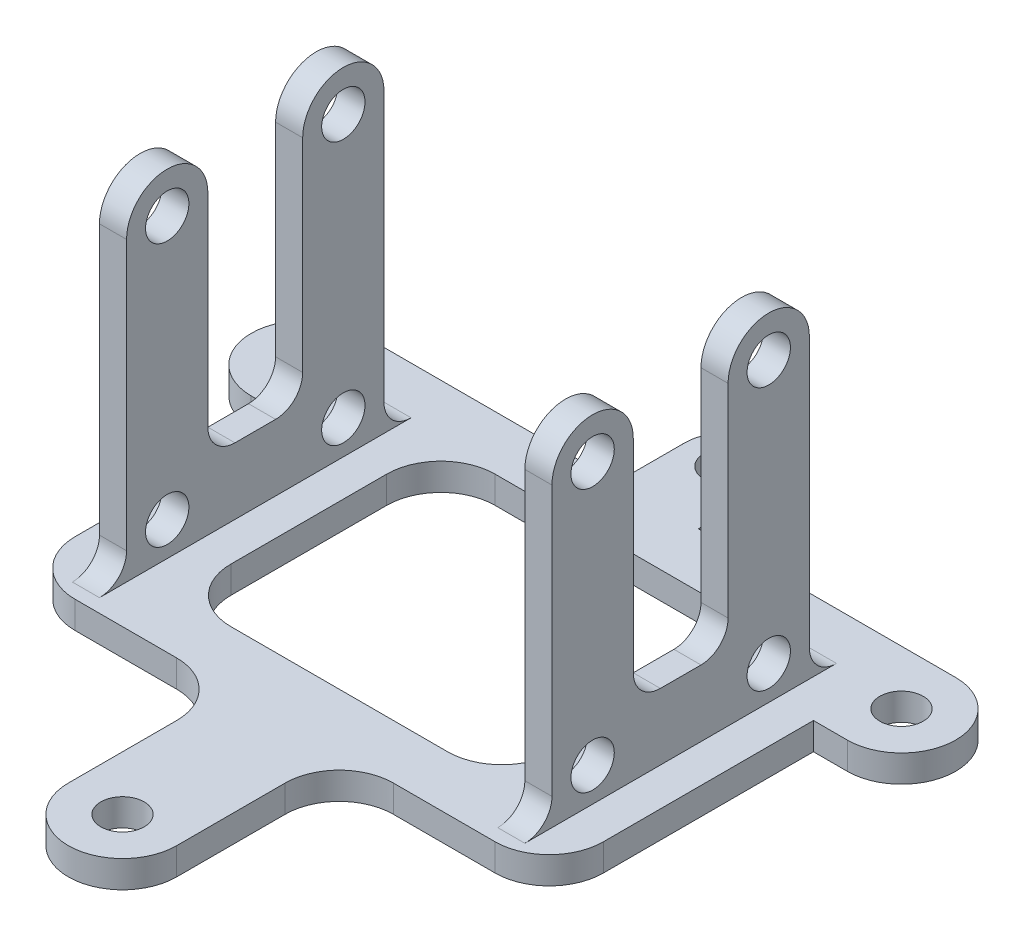
from build123d import *
from build123d.topology import SkipClean

# Parameters (mm, degrees)
SKETCH1_R                 = 1.6000000000000019
SKETCH1_R_2               = 1.5999999999999972
BOSS_EXTRUDE1_DEPTH       = 2
BOSS_EXTRUDE3_START       = -2
SKETCH2_R                 = 4
BOSS_EXTRUDE3_DEPTH       = 2
CUT_EXTRUDE2_START        = -4
SKETCH4_R                 = 1.5999999999999994
CUT_EXTRUDE2_DEPTH        = 4
CUT_EXTRUDE3_DEPTH        = 10
SKETCH6_R                 = 3
SKETCH6_R_2               = 1.6
BOSS_EXTRUDE4_DEPTH       = 2
SKETCH7_R                 = 1.5999999999999974
CUT_EXTRUDE4_DEPTH        = 10
CUT_EXTRUDE6_DEPTH        = 9.500000000000002
FILLET3_R                 = 3
SKETCH9_R                 = 1.5999999999999999
BOSS_EXTRUDE5_DEPTH       = 2
SKETCH10_R                = 1.6000000000000003
BOSS_EXTRUDE6_DEPTH       = 2
SKETCH11_R                = 1.6
CUT_EXTRUDE7_DEPTH        = 10
BOSS_EXTRUDE7_DEPTH       = 2
SKETCH13_R                = 1.6
CUT_EXTRUDE9_DEPTH        = 5.500000000000001
BOSS_EXTRUDE8_START       = -2
BOSS_EXTRUDE8_DEPTH       = 2
SKETCH16_R                = 1.5999999999999994
CUT_EXTRUDE10_DEPTH       = 10
SKETCH17_R                = 2.8848996867032946
BOSS_EXTRUDE9_DEPTH       = 0.9999999999999966
SKETCH18_R                = 1.5999999999999992
BOSS_EXTRUDE10_DEPTH      = 3
CUT_EXTRUDE11_START       = -2
SKETCH19_R                = 1.5999999999999985
SKETCH19_R_2              = 1.5000000000000004
CUT_EXTRUDE11_DEPTH       = 2
SKETCH20_R                = 1.5999999999999994
CUT_EXTRUDE12_DEPTH       = 10
SKETCH21_R                = 1.5000000000000018
CUT_EXTRUDE13_DEPTH       = 8.5
BOSS_EXTRUDE12_DEPTH      = 25
BOSS_EXTRUDE12_DEPTH_BACK = 1.9999999999999931
CUT_EXTRUDE14_DEPTH       = 48
SKETCH24_R                = 1.6000000000000019
SKETCH24_R_2              = 1.6
CUT_EXTRUDE15_DEPTH       = 48
BOSS_EXTRUDE13_DEPTH      = 2
BOSS_EXTRUDE14_DEPTH      = 2
CUT_EXTRUDE16_DEPTH       = 48
FILLET4_R                 = 3
CUT_EXTRUDE17_DEPTH       = 48
SKETCH29_R                = 4.000000000000001
SKETCH29_R_2              = 1.5999999999999979
BOSS_EXTRUDE15_DEPTH      = 2
FILLET5_R                 = 3
SKETCH30_R                = 1.5999999999999994
BOSS_EXTRUDE16_DEPTH      = 2
BOSS_EXTRUDE17_DEPTH      = 2
CUT_EXTRUDE18_DEPTH       = 10
FILLET6_R                 = 4
FILLET7_R                 = 2
SKETCH35_W                = 24
SKETCH35_H                = 7.9999999999999964
CUT_EXTRUDE19_DEPTH       = 10
FILLET8_R                 = 4
BOSS_EXTRUDE18_DEPTH      = 0.2
BOSS_EXTRUDE18_DEPTH_BACK = 33.2
SKETCH37_R                = 1.6000000000000019
CUT_EXTRUDE20_DEPTH       = 10
CUT_EXTRUDE20_DEPTH_BACK  = 31.2
SKETCH38_W                = 29.4
SKETCH38_H                = 8.202433025908348


with BuildPart() as part:
    # Sketch1 → Boss-Extrude1 (new body)
    with BuildSketch(Plane(origin=(0, 0, 0), x_dir=(1, 0, 0), z_dir=(0, 1, 0))):
        with BuildLine():
            Line((-3.999999999999999, -45), (-3.9999999999999964, -30))
            Line((-3.9999999999999964, -30), (-3.9999999999999982, -19))
            Line((-3.9999999999999982, -19), (-21.999999999999993, -19.000000000000007))
            ThreePointArc((-21.999999999999993, -19.000000000000007), (-24.828427124746185, -17.8284271247462), (-25.999999999999993, -15.000000000000007))
            Line((-25.999999999999993, -15.000000000000007), (-26, -5.000000000000007))
            ThreePointArc((-26, -5.000000000000007), (-24.82842712474619, -2.171572875253817), (-22, -1.000000000000006))
            Line((-22, -1.000000000000006), (-4, -1.0000000000000018))
            Line((-4, -1.0000000000000018), (-4, 0))
            ThreePointArc((-4, 0), (2.4e-16, 4), (4, 0))
            Line((4, 0), (4, -1.0000000000000009))
            Line((4, -1.0000000000000009), (22, -1.0000000000000009))
            ThreePointArc((22, -1.0000000000000009), (24.82842712474619, -2.17157287525381), (26, -5))
            Line((26, -5), (26, -15))
            ThreePointArc((26, -15), (24.82842712474619, -17.82842712474619), (22, -19))
            Line((22, -19), (4.0000000000000036, -19))
            Line((4.0000000000000036, -19), (4.0000000000000036, -30))
            Line((4.0000000000000036, -30), (4.000000000000003, -45))
            ThreePointArc((4.000000000000003, -45), (1.1e-15, -49), (-3.999999999999999, -45))
        make_face()
        with Locations(Location((-22, -5.000000000000005, 0), (0, 0, 270))):
            Circle(SKETCH1_R, mode=Mode.SUBTRACT)
        with Locations(Location((0, 0, 0), (0, 0, 270))):
            Circle(SKETCH1_R_2, mode=Mode.SUBTRACT)
        with Locations(Location((22, -5, 0), (0, 0, 270))):
            Circle(SKETCH1_R, mode=Mode.SUBTRACT)
        with Locations(Location((22, -15, 0), (0, 0, 270))):
            Circle(SKETCH1_R, mode=Mode.SUBTRACT)
        with Locations(Location((-21.999999999999993, -15.000000000000007, 0), (0, 0, 270))):
            Circle(SKETCH1_R, mode=Mode.SUBTRACT)
        with BuildLine():
            ThreePointArc((-1.5999999999999976, -45), (1.54e-15, -46.6), (1.6000000000000012, -45))
            Line((1.6000000000000012, -45), (1.6000000000000032, -30))
            ThreePointArc((1.6000000000000032, -30), (3.77e-15, -28.400000000000002), (-1.5999999999999956, -30))
            Line((-1.5999999999999956, -30), (-1.5999999999999976, -45))
        make_face(mode=Mode.SUBTRACT)
    extrude(amount=BOSS_EXTRUDE1_DEPTH)

    # Sketch2 → Boss-Extrude3 (add)
    with BuildSketch(Plane(origin=(0, 2, 0), x_dir=(1, 0, 0), z_dir=(0, 1, 0)).offset(BOSS_EXTRUDE3_START)):
        with BuildLine():
            ThreePointArc((-3.708099243547754, 1.500000000000191), (-2.7973447819472734, 2.8591715882248763), (-1.4185908501044255, 3.74))
            ThreePointArc((-1.4185908501044262, 3.7400000000000015), (4.5e-16, 4.6000000000000005), (1.4185908501044269, 3.74))
            ThreePointArc((1.4185908501044269, 3.7399999999999998), (2.797344781947271, 2.859171588224878), (3.708099243547752, 1.500000000000196))
            ThreePointArc((3.7080992435479154, 1.5000000000002072), (3.9263467099959257, 2.235930950172584), (4, 2.999999999999999))
            ThreePointArc((4, 3), (2.4e-16, 7), (-4, 3.0000000000000004))
            ThreePointArc((-4, 3.0000000000000004), (-3.9263467099959253, 2.235930950172582), (-3.708099243547913, 1.500000000000202))
        make_face()
        with BuildLine():
            ThreePointArc((4, 2.999999999999999), (3.9263467099959257, 2.235930950172584), (3.7080992435479154, 1.5000000000002072))
            ThreePointArc((3.708099243547752, 1.500000000000196), (3.9263467099958844, 0.764069049827629), (4, 0))
            Line((4, 0), (4, 3))
        make_face()
        with BuildLine():
            ThreePointArc((-4, 4.9e-16), (-3.926346709995885, 0.7640690498276264), (-3.708099243547754, 1.500000000000191))
            ThreePointArc((-3.708099243547913, 1.500000000000202), (-3.9263467099959253, 2.235930950172582), (-4, 3.0000000000000004))
            Line((-4, 3), (-4, 0))
        make_face()
        Circle(SKETCH2_R)
    extrude(amount=BOSS_EXTRUDE3_DEPTH)

    # Sketch4 → Cut-Extrude2 (cut)
    with SkipClean():  # the faces are left unmerged after this step: merging them gives an invalid solid
        with BuildSketch(Plane(origin=(0, 2, 0), x_dir=(1, 0, 0), z_dir=(0, 1, 0)).offset(CUT_EXTRUDE2_START)):
            with Locations(Location((0, 3, 0), (0, 0, 270))):
                Circle(SKETCH4_R)
        extrude(amount=CUT_EXTRUDE2_DEPTH, mode=Mode.SUBTRACT)

    # Sketch5 → Cut-Extrude3 (cut)
    with BuildSketch(Plane(origin=(0, 2, 0), x_dir=(1, 0, 0), z_dir=(0, 1, 0))):
        Polygon((-4, -1.0000000000000018), (4, -1.0000000000000009), (9.121752044416558, 12.895203900090412), (-11.957584594920363, 14.407484273922782), align=None)
    extrude(amount=-CUT_EXTRUDE3_DEPTH, mode=Mode.SUBTRACT)

    # Sketch6 → Boss-Extrude4 (add)
    with BuildSketch(Plane(origin=(0, 2, 0), x_dir=(1, 0, 0), z_dir=(0, 1, 0))):
        with Locations((0, -1.0000000000000036)):
            Circle(SKETCH6_R)
        with Locations((0, -1.0000000000000036)):
            Circle(SKETCH6_R_2, mode=Mode.SUBTRACT)
    extrude(amount=-BOSS_EXTRUDE4_DEPTH)

    # Sketch7 → Cut-Extrude4 (cut)
    with BuildSketch(Plane(origin=(0, 2, 0), x_dir=(1, 0, 0), z_dir=(0, 1, 0))):
        with Locations(Location((0, -1.0000000000000009, 0), (0, 0, 270))):
            Circle(SKETCH7_R)
    extrude(amount=-CUT_EXTRUDE4_DEPTH, mode=Mode.SUBTRACT)

    # Sketch8 → Cut-Extrude6 (cut)
    with BuildSketch(Plane(origin=(0, 2, 0), x_dir=(1, 0, 0), z_dir=(0, 1, 0))):
        Polygon((-17.999999999999996, -5.000000000000005), (18, -5), (18, -15), (-17.99999999999999, -15.000000000000007), align=None)
    extrude(amount=-CUT_EXTRUDE6_DEPTH, mode=Mode.SUBTRACT)

    # Fillet3
    fillet3_edges = [part.edges().sort_by_distance(p)[0] for p in [
        (-17.999999999999996, 1, 5.000000000000005),
        (18, 1, 5),
        (18, 1, 15),
        (-17.99999999999999, 1, 15.000000000000007),
    ]]
    fillet(fillet3_edges, radius=FILLET3_R)

    # Sketch9 → Boss-Extrude5 (add)
    with BuildSketch(Plane(origin=(0, 2, 0), x_dir=(1, 0, 0), z_dir=(0, 1, 0))):
        with Locations((0, -1.0000000000000036)):
            Circle(SKETCH9_R)
    extrude(amount=-BOSS_EXTRUDE5_DEPTH)

    # Sketch10 → Boss-Extrude6 (add)
    with BuildSketch(Plane(origin=(0, 2, 0), x_dir=(1, 0, 0), z_dir=(0, 1, 0))):
        with BuildLine():
            Line((3.0000000000000004, -1.0000000000000009), (3.0000000000000004, 2.999999999999999))
            ThreePointArc((3.0000000000000004, 2.999999999999999), (-6.8e-16, 6), (-3.0000000000000004, 2.999999999999999))
            Line((-3.0000000000000004, 2.999999999999999), (-3.0000000000000004, -1.0000000000000244))
            Line((-3.0000000000000004, -1.0000000000000244), (3.0000000000000004, -1.0000000000000009))
        make_face()
        with Locations((-8.7e-16, 2.999999999999999)):
            Circle(SKETCH10_R, mode=Mode.SUBTRACT)
    extrude(amount=-BOSS_EXTRUDE6_DEPTH)

    # Sketch11 → Cut-Extrude7 (cut)
    with BuildSketch(Plane(origin=(0, 2, 0), x_dir=(1, 0, 0), z_dir=(0, 1, 0))):
        with Locations(Location((-8.7e-16, 2.999999999999999, 0), (0, 0, 270))):
            Circle(SKETCH11_R)
    extrude(amount=-CUT_EXTRUDE7_DEPTH, mode=Mode.SUBTRACT)

    # Sketch12 → Boss-Extrude7 (add)
    with BuildSketch(Plane(origin=(0, 2, 0), x_dir=(1, 0, 0), z_dir=(0, 1, 0))):
        with BuildLine():
            Line((-3.0000000000000013, 2.9999999999999996), (-3, 3.999999999999999))
            ThreePointArc((-3, 3.999999999999999), (1.8e-16, 6.999999999999999), (3, 3.999999999999999))
            Line((3, 3.999999999999999), (3.0000000000000004, 2.999999999999999))
            Line((3.0000000000000004, 2.999999999999999), (2.8284271247461903, 2.999999999999999))
            ThreePointArc((2.8284271247461903, 2.999999999999999), (1.8e-16, 0.9999999999999991), (-2.8284271247461903, 2.999999999999999))
            Line((-2.8284271247461903, 2.999999999999999), (-3.0000000000000013, 2.9999999999999996))
        make_face()
    extrude(amount=-BOSS_EXTRUDE7_DEPTH)

    # Sketch13 → Cut-Extrude9 (cut)
    with BuildSketch(Plane(origin=(0, 2, 0), x_dir=(1, 0, 0), z_dir=(0, 1, 0))):
        with Locations(Location((0, 3.999999999999999, 0), (0, 0, 270))):
            Circle(SKETCH13_R)
    extrude(amount=-CUT_EXTRUDE9_DEPTH, mode=Mode.SUBTRACT)

    # Sketch15 → Boss-Extrude8 (add)
    with BuildSketch(Plane(origin=(0, 2, 0), x_dir=(1, 0, 0), z_dir=(0, 1, 0)).offset(BOSS_EXTRUDE8_START)):
        with BuildLine():
            Line((-3.999999999999999, -45), (-3.999999999999999, -23.95375005686752))
            Line((-3.999999999999999, -23.95375005686752), (4.000000000000003, -23.95375005686752))
            Line((4.000000000000003, -23.95375005686752), (4.000000000000003, -45))
            ThreePointArc((4.000000000000003, -45), (1.1e-15, -49), (-3.999999999999999, -45))
        make_face()
    extrude(amount=BOSS_EXTRUDE8_DEPTH)

    # Sketch16 → Cut-Extrude10 (cut)
    with BuildSketch(Plane(origin=(0, 2, 0), x_dir=(1, 0, 0), z_dir=(0, 1, 0))):
        with Locations(Location((1.84e-15, -45, 0), (0, 0, 270))):
            Circle(SKETCH16_R)
        with Locations(Location((4.9e-15, -36.00000000000001, 0), (0, 0, 270))):
            Circle(SKETCH16_R)
    extrude(amount=-CUT_EXTRUDE10_DEPTH, mode=Mode.SUBTRACT)

    # Sketch17 → Boss-Extrude9 (add)
    with BuildSketch(Plane(origin=(0, 2, 0), x_dir=(1, 0, 0), z_dir=(0, 1, 0))):
        with Locations((4.9e-15, -36.00000000000001)):
            Circle(SKETCH17_R)
    extrude(amount=-BOSS_EXTRUDE9_DEPTH)

    # Sketch18 → Boss-Extrude10 (add)
    with BuildSketch(Plane(origin=(0, 1.0000000000000036, 0), x_dir=(-1, 0, 0), z_dir=(0, -1, 0))):
        with Locations(Location((-4.9e-15, -36.00000000000001, 0), (0, 0, 270))):
            Circle(SKETCH18_R)
    extrude(amount=BOSS_EXTRUDE10_DEPTH)

    # Sketch19 → Cut-Extrude11 (cut)
    with BuildSketch(Plane(origin=(0, -1.9999999999999967, 0), x_dir=(-1, 0, 0), z_dir=(0, -1, 0)).offset(CUT_EXTRUDE11_START)):
        with Locations((-4.9e-15, -36.00000000000001)):
            Circle(SKETCH19_R)
        with Locations(Location((-4.9e-15, -36.00000000000001, 0), (0, 0, 90))):
            Circle(SKETCH19_R_2, mode=Mode.SUBTRACT)
    extrude(amount=CUT_EXTRUDE11_DEPTH, mode=Mode.SUBTRACT)

    # Sketch20 → Cut-Extrude12 (cut)
    with BuildSketch(Plane(origin=(0, 0, 0), x_dir=(-1, 0, 0), z_dir=(0, -1, 0))):
        with Locations(Location((5.5e-16, -40.5, 0), (0, 0, 90))):
            Circle(SKETCH20_R)
    extrude(amount=-CUT_EXTRUDE12_DEPTH, mode=Mode.SUBTRACT)

    # Sketch21 → Cut-Extrude13 (cut)
    with BuildSketch(Plane(origin=(0, 0, 0), x_dir=(-1, 0, 0), z_dir=(0, -1, 0))):
        with Locations((-4.9e-15, -36.00000000000001)):
            Circle(SKETCH21_R)
    extrude(amount=CUT_EXTRUDE13_DEPTH, mode=Mode.SUBTRACT)

    # Sketch22 → Boss-Extrude12 (add, two sides: drawn at the far end of the back side and taken through both)
    with BuildSketch(Plane(origin=(0, 2, 0), x_dir=(1, 0, 0), z_dir=(0, 1, 0)).offset(-BOSS_EXTRUDE12_DEPTH_BACK)):
        Polygon((-16.499999999999993, -15.000000000000007), (-16.499999999999993, -6.500000000000005), (-14.664886756065696, -6.500000000000005), (-14.664886756065695, -25.500000000000004), (-16.499999999999993, -25.500000000000004), align=None)
        Polygon((16.499999999999993, -25.500000000000004), (16.499999999999993, -15.000000000000007), (16.499999999999993, -6.500000000000005), (14.499999999999995, -6.500000000000005), (14.499999999999993, -25.500000000000004), align=None)
    extrude(amount=BOSS_EXTRUDE12_DEPTH + BOSS_EXTRUDE12_DEPTH_BACK)

    # Sketch23 → Cut-Extrude14 (cut)
    with BuildSketch(Plane(origin=(16.499999999999993, 0, 0), x_dir=(0, 0, -1), z_dir=(1, 0, 0))):
        with BuildLine():
            Line((-25.500000000000004, 27.000000000000004), (-25.500000000000004, 23.9))
            ThreePointArc((-25.500000000000007, 23.9), (-22.500000000000007, 26.9), (-19.500000000000007, 23.9))
            Line((-19.500000000000004, 23.9), (-19.5, 6.899999999999999))
            Line((-19.5, 6.899999999999997), (-12.500000000000007, 6.899999999999997))
            Line((-12.500000000000007, 6.899999999999997), (-12.500000000000007, 23.9))
            ThreePointArc((-12.500000000000007, 23.9), (-9.500000000000007, 26.9), (-6.500000000000007, 23.9))
            Line((-6.500000000000005, 23.9), (-6.500000000000005, 27.000000000000004))
            Line((-6.500000000000005, 27.000000000000004), (-25.500000000000007, 27.000000000000004))
        make_face()
    extrude(amount=-CUT_EXTRUDE14_DEPTH, mode=Mode.SUBTRACT)

    # Sketch24 → Cut-Extrude15 (cut)
    with BuildSketch(Plane(origin=(16.499999999999993, 0, 0), x_dir=(0, 0, -1), z_dir=(1, 0, 0))):
        with Locations((-22.500000000000007, 23.9)):
            Circle(SKETCH24_R)
        with Locations((-9.500000000000007, 23.9)):
            Circle(SKETCH24_R_2)
        with Locations((-22.500000000000004, 4.500000000000001)):
            Circle(SKETCH24_R)
        with Locations((-9.500000000000007, 4.500000000000001)):
            Circle(SKETCH24_R_2)
    extrude(amount=-CUT_EXTRUDE15_DEPTH, mode=Mode.SUBTRACT)

    # Sketch25 → Boss-Extrude13 (add)
    with BuildSketch(Plane(origin=(0, 0, 0), x_dir=(-1, 0, 0), z_dir=(0, -1, 0))):
        Polygon((14.664886756065696, -6.500000000000005), (14.664886756065696, -3.5087335984680297), (19.1283871992999, -3.5087335984680297), (19.1283871992999, -15.856455710850426), (14.664886756065696, -15.856455710850426), align=None)
        Polygon((-14.499999999999995, -6.783756667702066), (-14.499999999999993, -16.697340012410514), (-19.375262398451664, -16.697340012410514), (-19.375262398451664, -3.5087335984680297), (-14.499999999999995, -3.5087335984680297), align=None)
    extrude(amount=-BOSS_EXTRUDE13_DEPTH)

    # Sketch26 → Boss-Extrude14 (add)
    with BuildSketch(Plane(origin=(0, 0, 0), x_dir=(-1, 0, 0), z_dir=(0, -1, 0))):
        Polygon((14.664886756065695, -25.500000000000004), (-14.499999999999993, -25.500000000000004), (-14.499999999999993, -19), (14.664886756065695, -19.000000000000007), align=None)
    extrude(amount=-BOSS_EXTRUDE14_DEPTH)

    # Sketch27 → Cut-Extrude16 (cut)
    with BuildSketch(Plane(origin=(0, 2, 0), x_dir=(1, 0, 0), z_dir=(0, 1, 0))):
        Polygon((4.0000000000000036, -20.500000000000004), (-3.9999999999999964, -20.500000000000004), (-11.999999999999996, -20.500000000000004), (-11.999999999999996, -15.000000000000007), (4.0000000000000036, -15.000000000000002), (12.000000000000004, -15), (12.000000000000004, -20.500000000000004), align=None)
    extrude(amount=-CUT_EXTRUDE16_DEPTH, mode=Mode.SUBTRACT)

    # Fillet4
    # the kernel refuses this fillet: 3 mm, written as the material it adds along each edge
    with BuildSketch(Plane(origin=(-3.999999999999996, 2, 25.500000000000004), x_dir=(-1, 0, 0), z_dir=(0, -1, 0))) as fillet4_piece_1:
        with BuildLine():
            CenterArc((FILLET4_R, -FILLET4_R), FILLET4_R, 90, 90)
            Line((4.4e-16, -FILLET4_R), (0, 0))
            Line((0, 0), (FILLET4_R, 0))
        make_face()
    extrude(amount=2)
    with BuildSketch(Plane(origin=(4.0000000000000036, 0, 25.500000000000004), x_dir=(1, 0, 0), z_dir=(0, 1, 0))) as fillet4_piece_2:
        with BuildLine():
            CenterArc((FILLET4_R, -FILLET4_R), FILLET4_R, 90, 90)
            Line((0, -FILLET4_R), (0, 0))
            Line((0, 0), (FILLET4_R, 0))
        make_face()
    extrude(amount=2)
    with BuildSketch(Plane(origin=(16.499999999999993, 2, 19), x_dir=(1, 0, 0), z_dir=(0, -1, 0)), Plane(origin=(-16.499999999999993, 2, 19.000000000000007), x_dir=(0, 0, 1), z_dir=(0, -1, 0))) as fillet4_piece_3:
        with BuildLine():
            CenterArc((FILLET4_R, FILLET4_R), FILLET4_R, 180, 90)
            Line((0, FILLET4_R), (0, 0))
            Line((0, 0), (FILLET4_R, 0))
        make_face()
    extrude(amount=1.9999999999999931)
    # the kernel refuses this fillet: 3 mm, written as the material it takes off along each edge
    with BuildSketch(Plane(origin=(12.000000000000004, 9.395099728875287, 15), x_dir=(1, 0, 1.2008e-13), z_dir=(0, -1, 0))) as fillet4_2_piece_1:
        with BuildLine():
            CenterArc((3.0000000000003553, 2.9580398915497548), FILLET4_R, 179.99999999999312, 80.40593177314037)
            Line((3.5521e-13, 2.958039891550115), (0, 0))
            Line((0, 0), (2.5000000000000426, 0))
        make_face()
    extrude(amount=16.790199457750575, mode=Mode.SUBTRACT)
    with BuildSketch(Plane(origin=(-11.999999999999996, 9.453061079910315, 15.000000000000007), x_dir=(0, 0, 1), z_dir=(0, -1, 0))) as fillet4_2_piece_2:
        with BuildLine():
            CenterArc((2.981224431964126, 3), FILLET4_R, 186.41357694190813, 83.5864230580919)
            Line((-1.78e-15, 2.6648867560657017), (0, 0))
            Line((0, 0), (2.981224431964126, 0))
        make_face()
    extrude(amount=16.90612215982063, mode=Mode.SUBTRACT)

    # Sketch28 → Cut-Extrude17 (cut)
    with BuildSketch(Plane(origin=(0, 2, 0), x_dir=(1, 0, 0), z_dir=(0, 1, 0))):
        with BuildLine():
            Line((-3.999999999999999, -45), (-3.9999999999999982, -40.5))
            Line((-4.000000000000005, -40.5), (-24.834858507184848, -51.1299447852437))
            Line((-24.834858507184848, -51.1299447852437), (5.50593116836319, -58.37718786368524))
            Line((5.50593116836319, -58.37718786368524), (27.5856147441333, -52.63196407611241))
            Line((27.5856147441333, -52.63196407611241), (27.5856147441333, -52.218908771123516))
            Line((27.5856147441333, -52.218908771123516), (4.0000000000000036, -40.5))
            Line((4.000000000000003, -40.5), (4.000000000000003, -45))
            ThreePointArc((4.000000000000002, -45), (1.75e-15, -49), (-3.9999999999999982, -45))
        make_face()
        with BuildLine():
            ThreePointArc((-1.4097714550789981, -44.24333333333334), (-3.2893073602444054, -42.77606175000636), (-4.000000000000005, -40.5))
            Line((-3.9999999999999982, -40.5), (-3.999999999999999, -45))
            ThreePointArc((-3.9999999999999982, -45), (1.75e-15, -49), (4.000000000000002, -45))
            Line((4.000000000000003, -45), (4.000000000000003, -40.5))
            ThreePointArc((4.0000000000000036, -40.5), (3.2893073602444036, -42.77606175000636), (1.409771455078996, -44.24333333333334))
            ThreePointArc((1.4097714550789944, -44.243333333333325), (1.5517142662433694, -44.6098938145366), (1.6000000000000012, -45))
            ThreePointArc((1.6000000000000012, -45), (-0.3901061854633988, -46.551714266243366), (-1.4097714550789913, -44.243333333333325))
        make_face()
    extrude(amount=-CUT_EXTRUDE17_DEPTH, mode=Mode.SUBTRACT)

    # Sketch29 → Boss-Extrude15 (add)
    with BuildSketch(Plane(origin=(0, 2, 0), x_dir=(1, 0, 0), z_dir=(0, 1, 0))):
        with Locations((-5.5e-16, -40.5)):
            Circle(SKETCH29_R)
        with Locations(Location((-5.5e-16, -40.5, 0), (0, 0, 90))):
            Circle(SKETCH29_R_2, mode=Mode.SUBTRACT)
    extrude(amount=-BOSS_EXTRUDE15_DEPTH)

    # Fillet5
    fillet5_edges = [part.edges().sort_by_distance(p)[0] for p in [
        (-14.664886756065698, 1.0000000000000036, 15.000000000000007),
        (14.499999999999995, 1.0000000000000036, 15),
    ]]
    fillet(fillet5_edges, radius=FILLET5_R)

    # Sketch30 → Boss-Extrude16 (add)
    # profile 1 of 3: a face of its own
    with BuildSketch(Plane(origin=(0, 2, 0), x_dir=(1, 0, 0), z_dir=(0, 1, 0))):
        with BuildLine():
            ThreePointArc((-13.332443378032846, -15.487381030197795), (-12.353996422347327, -16.56748291844433), (-11.999999999999996, -17.981224431964137))
            Line((-11.999999999999996, -17.981224431964137), (-11.999999999999996, -5.0000000000000036))
            Line((-11.999999999999996, -5.000000000000004), (-14.664886756065696, -5.000000000000004))
            Line((-14.664886756065696, -5.000000000000004), (-14.664886756065695, -12.993537628431456))
            ThreePointArc((-14.664886756065695, -12.993537628431456), (-14.310890333718365, -14.407279141951264), (-13.332443378032846, -15.487381030197795))
        make_face()
    # profile 2 of 3: a face of its own
    with BuildSketch(Plane(origin=(0, 2, 0), x_dir=(1, 0, 0), z_dir=(0, 1, 0))):
        with BuildLine():
            Line((12.000000000000004, -5), (12.000000000000004, -17.958039891549806))
            ThreePointArc((12.000000000000004, -17.958039891549806), (12.330730436992173, -16.588733497786894), (13.249999999999998, -15.521341305347566))
            ThreePointArc((13.249999999999998, -15.521341305347567), (14.169269563007823, -14.453949112908244), (14.499999999999993, -13.08464271914533))
            Line((14.499999999999993, -13.084642719145329), (14.499999999999995, -5.000000000000001))
            Line((14.499999999999995, -5.000000000000001), (12.000000000000004, -5.000000000000001))
        make_face()
    # profile 3 of 3: a face of its own
    with BuildSketch(Plane(origin=(0, 2, 0), x_dir=(1, 0, 0), z_dir=(0, 1, 0))):
        with BuildLine():
            Line((12.000000000000004, -20.500000000000004), (-11.999999999999996, -20.500000000000004))
            Line((-11.999999999999996, -20.500000000000004), (-14.664886756065693, -20.500000000000004))
            Line((-14.664886756065695, -20.500000000000004), (-14.664886756065695, -25.500000000000004))
            Line((-14.664886756065695, -25.500000000000004), (-6.9999999999999964, -25.500000000000004))
            ThreePointArc((-6.9999999999999964, -25.500000000000004), (-4.8786796564403545, -26.37867965644036), (-3.9999999999999956, -28.500000000000004))
            Line((-3.9999999999999964, -28.500000000000004), (-4, -40.50000000000001))
            ThreePointArc((-4.000000000000002, -40.50000000000001), (2.64e-15, -44.5), (4.000000000000007, -40.50000000000001))
            Line((4.000000000000005, -40.50000000000001), (4.0000000000000036, -28.500000000000004))
            ThreePointArc((4.000000000000003, -28.500000000000004), (4.878679656440362, -26.37867965644036), (7.000000000000003, -25.500000000000004))
            Line((7.000000000000003, -25.500000000000004), (14.499999999999993, -25.500000000000004))
            Line((14.499999999999993, -25.500000000000004), (14.499999999999993, -20.5))
            Line((14.499999999999993, -20.5), (12.000000000000004, -20.500000000000004))
        make_face()
        with Locations(Location((-5.5e-16, -40.5, 0), (0, 0, 90))):
            Circle(SKETCH30_R, mode=Mode.SUBTRACT)
    extrude(amount=-BOSS_EXTRUDE16_DEPTH)

    # Sketch31 → Boss-Extrude17 (add)
    with BuildSketch(Plane(origin=(0, 2, 0), x_dir=(1, 0, 0), z_dir=(0, 1, 0))):
        Polygon((-19.499999999999993, -19.000000000000007), (-19.499999999999993, -28.500000000000004), (-3.9999999999999964, -28.500000000000004), (-3.9999999999999964, -20.500000000000004), (-14.664886756065695, -20.500000000000004), (-14.664886756065695, -19.000000000000007), align=None)
        Polygon((14.499999999999993, -19.000000000000007), (19.499999999999993, -19.000000000000007), (19.499999999999993, -28.500000000000004), (3.9999999999999964, -28.500000000000004), (3.9999999999999964, -20.500000000000004), (14.499999999999993, -20.500000000000004), align=None)
    extrude(amount=-BOSS_EXTRUDE17_DEPTH)

    # Sketch34 → Cut-Extrude18 (cut)
    with BuildSketch(Plane.XZ):
        with BuildLine():
            Line((-19.499999999999993, 19.000000000000007), (-19.499999999999993, 9.000000000000005))
            Line((-19.499999999999993, 9.000000000000005), (-22, 9.000000000000005))
            ThreePointArc((-22, 9.000000000000005), (-24.82842712474619, 7.828427124746195), (-26, 5.000000000000005))
            Line((-26, 5.000000000000005), (-35.11330830520048, 22.636347709612025))
            Line((-35.11330830520048, 22.636347709612025), (-23.296728077087415, 23.169426516895324))
            Line((-23.296728077087415, 23.169426516895324), (-19.499999999999993, 19.000000000000007))
        make_face()
        with BuildLine():
            Line((19.499999999999993, 19.000000000000007), (19.499999999999996, 9.000000000000005))
            Line((19.499999999999996, 9.000000000000005), (22, 9.000000000000004))
            ThreePointArc((22, 9.000000000000004), (24.82842712474619, 7.82842712474619), (26, 5))
            Line((26, 5), (32.36558405007679, 16.283825256152742))
            Line((32.36558405007679, 16.283825256152742), (22.37035641351498, 25.21289527814796))
            Line((22.37035641351498, 25.21289527814796), (19.499999999999993, 19.000000000000007))
        make_face()
    extrude(amount=-CUT_EXTRUDE18_DEPTH, mode=Mode.SUBTRACT)

    # Fillet6
    fillet6_edges = [part.edges().sort_by_distance(p)[0] for p in [
        (12.000000000000004, 1, 20.500000000000004),
        (-11.999999999999996, 1, 20.500000000000004),
        (-4, 1, 28.5),
        (4, 1, 28.5),
        (-11.999999999999996, 1, 5.0000000000000036),
        (12.000000000000004, 1, 5),
        (-19.499999999999993, 1, 28.500000000000004),
        (19.499999999999993, 1, 28.500000000000004),
    ]]
    fillet(fillet6_edges, radius=FILLET6_R)

    # Fillet7
    fillet7_edges = [part.edges().sort_by_distance(p)[0] for p in [
        (-15.582443378032842, 6.899999999999997, 12.500000000000007),
        (-15.582443378032842, 6.899999999999998, 19.5),
        (15.499999999999993, 6.899999999999997, 12.500000000000007),
        (15.499999999999993, 6.899999999999998, 19.5),
        (-15.582443378032846, 2, 6.500000000000005),
        (15.499999999999993, 2, 6.500000000000005),
        (-15.582443378032844, 2, 25.500000000000004),
        (15.499999999999993, 2, 25.500000000000004),
    ]]
    fillet(fillet7_edges, radius=FILLET7_R)

    # Sketch35 → Cut-Extrude19 (cut)
    with BuildSketch(Plane(origin=(0, 2, 0), x_dir=(1, 0, 0), z_dir=(0, 1, 0))):
        with Locations((3.55e-15, -20.5)):
            Rectangle(SKETCH35_W, SKETCH35_H)
    extrude(amount=-CUT_EXTRUDE19_DEPTH, mode=Mode.SUBTRACT)

    # Fillet8
    fillet8_edges = [part.edges().sort_by_distance(p)[0] for p in [
        (12.000000000000004, 1, 24.500000000000004),
        (-11.999999999999996, 1, 24.500000000000004),
    ]]
    fillet(fillet8_edges, radius=FILLET8_R)

    # Sketch37 → Boss-Extrude18 (add, two sides: drawn at the far end of the back side and taken through both)
    with BuildSketch(Plane(origin=(16.499999999999993, 0, 0), x_dir=(0, 0, -1), z_dir=(1, 0, 0)).offset(-BOSS_EXTRUDE18_DEPTH_BACK)):
        with BuildLine():
            Line((-27.499999999999982, 2.000000000000001), (-4.500000000000005, 2))
            ThreePointArc((-4.500000000000005, 2), (-5.914213562373093, 2.5857864376269024), (-6.500000000000005, 3.9999999999999862))
            Line((-6.500000000000005, 3.9999999999999862), (-6.500000000000005, 23.9))
            ThreePointArc((-6.500000000000005, 23.9), (-9.500000000000018, 26.9), (-12.500000000000007, 23.899999999999977))
            Line((-12.500000000000007, 23.899999999999977), (-12.500000000000007, 8.899999999999997))
            ThreePointArc((-12.500000000000007, 8.899999999999997), (-13.085786437626913, 7.485786437626903), (-14.500000000000007, 6.899999999999997))
            Line((-14.500000000000007, 6.899999999999997), (-17.500000000000004, 6.899999999999997))
            ThreePointArc((-17.500000000000004, 6.899999999999997), (-18.914213562373096, 7.485786437626904), (-19.500000000000004, 8.899999999999997))
            Line((-19.500000000000004, 8.899999999999997), (-19.500000000000004, 23.9))
            ThreePointArc((-19.500000000000004, 23.9), (-22.500000000000018, 26.9), (-25.500000000000007, 23.899999999999977))
            Line((-25.500000000000007, 23.899999999999977), (-25.500000000000004, 4))
            ThreePointArc((-25.500000000000004, 4), (-26.0857864376269, 2.585786437626912), (-27.499999999999982, 2.000000000000001))
        make_face()
        with Locations((-22.500000000000007, 23.9)):
            Circle(SKETCH37_R, mode=Mode.SUBTRACT)
        with Locations((-9.500000000000007, 23.9)):
            Circle(SKETCH37_R, mode=Mode.SUBTRACT)
        with Locations((-9.500000000000007, 4.500000000000001)):
            Circle(SKETCH37_R, mode=Mode.SUBTRACT)
        with Locations((-22.500000000000004, 4.500000000000001)):
            Circle(SKETCH37_R, mode=Mode.SUBTRACT)
    extrude(amount=BOSS_EXTRUDE18_DEPTH + BOSS_EXTRUDE18_DEPTH_BACK)

    # Sketch38 → Cut-Extrude20 (cut, two sides: drawn at the far end of the back side and taken through both)
    with BuildSketch(Plane.XY.offset(25.500000000000004).offset(-CUT_EXTRUDE20_DEPTH_BACK)):
        Polygon((-14.700000000000012, 23.899999999999977), (-14.70000000000001, 13.949999999999989), (-14.700000000000008, 4), (14.699999999999992, 4), (14.69999999999999, 13.949999999999989), (14.699999999999989, 23.899999999999977), align=None)
        with Locations((-1.155e-14, 28.00121651295415)):
            Rectangle(SKETCH38_W, SKETCH38_H)
        Polygon((14.699999999999992, 4), (-14.700000000000008, 4), (-14.700000000000008, 2), (14.69999999999999, 2), align=None)
    extrude(amount=CUT_EXTRUDE20_DEPTH + CUT_EXTRUDE20_DEPTH_BACK, mode=Mode.SUBTRACT)


solid = part.part
